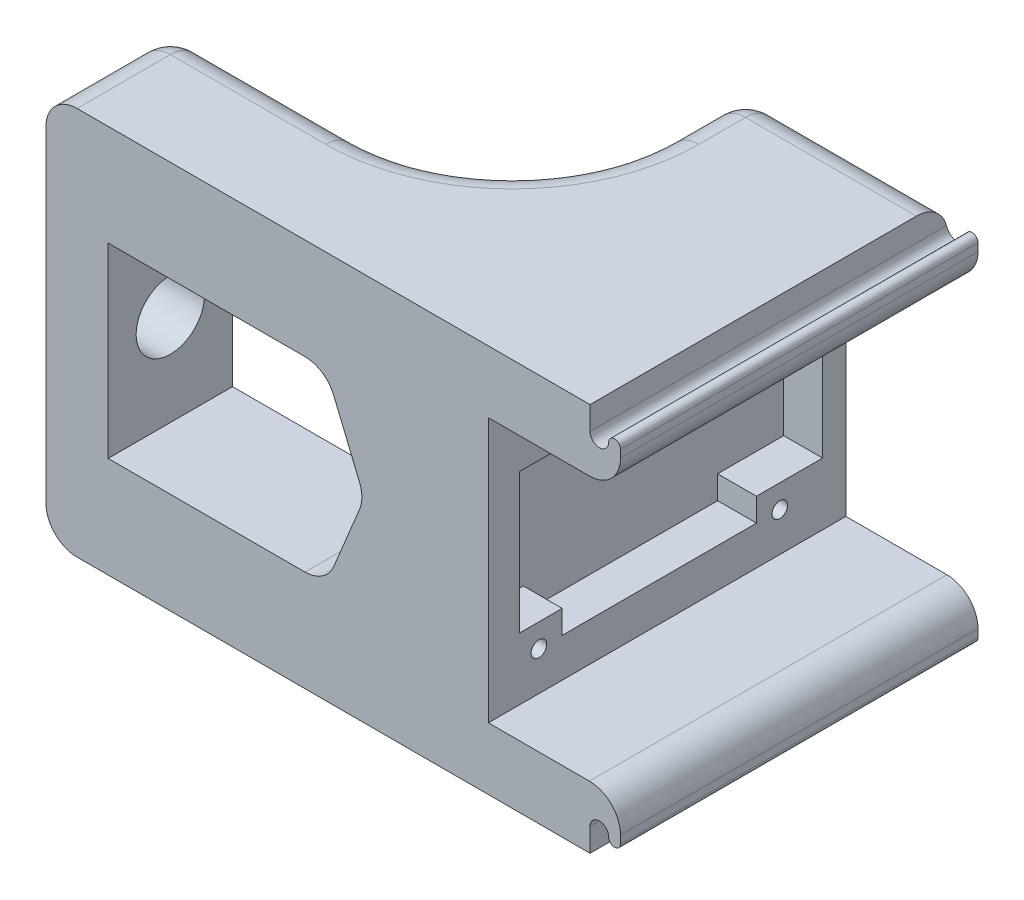
from build123d import *

# Parameters (mm, degrees)
P_IDAT_VYSUNUT_M1_DEPTH  = 8
SKICA2_R                 = 2.2
ODEBRAT_VYSUNUT_M1_DEPTH = 8
P_IDAT_VYSUNUT_M3_DEPTH  = 15
ZAOBLIT3_R               = 10
ZAOBLIT5_R               = 2
ZAOBLIT6_R               = 2
ZAOBLIT7_R               = 2
P_IDAT_VYSUNUT_M6_DEPTH  = 23
ZAOBLIT12_R              = 2
ZAOBLIT13_R              = 2
ZAOBLIT14_R              = 2
ZAOBLIT15_R              = 2
ODEBRAT_VYSUNUT_M4_DEPTH = 8.5
ZAOBLIT18_R              = 2
ZAOBLIT19_R              = 2
SKICA8_R                 = 0.5000000000000009
SKICA8_W                 = 12.000000000000004
SKICA8_H                 = 9
ODEBRAT_VYSUNUT_M5_DEPTH = 2
SKICA9_W                 = 12.000000000000004
SKICA9_H                 = 9
ODEBRAT_VYSUNUT_M6_DEPTH = 2.5


with BuildPart() as part:
    # Skica1 → Přidat vysunutím1 (new body)
    with BuildSketch(Plane.XY):
        Polygon((0, 0), (0, 25), (35, 25.000000000000004), (35, -3.47e-15), align=None)
        Polygon((3.999999999999999, 18.500000000000004), (4, 6.500000000000001), (18, 6.500000000000001), (20.485281374238575, 12.499999999999996), (18, 18.499999999999996), align=None, mode=Mode.SUBTRACT)
    extrude(amount=P_IDAT_VYSUNUT_M1_DEPTH)

    # Skica2 → Odebrat vysunutím1 (cut)
    with BuildSketch(Plane.ZY):
        with Locations((4, 12.5)):
            Circle(SKICA2_R)
    extrude(amount=-ODEBRAT_VYSUNUT_M1_DEPTH, mode=Mode.SUBTRACT)

    # Skica3 → Přidat vysunutím3 (add)
    with BuildSketch(Plane(origin=(0, 0, 0), x_dir=(-1, 0, 0), z_dir=(0, 0, -1))):
        Polygon((-35, 25.000000000000004), (-22, 25.000000000000004), (-21.999999999999996, 0), (-35, 0), align=None)
    extrude(amount=P_IDAT_VYSUNUT_M3_DEPTH)

    # Zaoblit3
    # the kernel refuses this fillet: 10 mm, written as the material it adds along each edge
    with BuildSketch(Plane(origin=(22, 25.000000000000004, 0), x_dir=(0, 0, -1), z_dir=(-1.4e-16, -1, 0))) as zaoblit3_piece_1_section:
        with BuildLine():
            CenterArc((ZAOBLIT3_R, -ZAOBLIT3_R), ZAOBLIT3_R, 90, 90)
            Line((-1.78e-15, -ZAOBLIT3_R), (0, 0))
            Line((0, 0), (ZAOBLIT3_R, 0))
        make_face()
    zaoblit3_piece_1 = extrude(amount=49.99999999999999, mode=Mode.PRIVATE)
    zaoblit3_piece_1 = split(zaoblit3_piece_1, bisect_by=Plane(origin=(17.13517134220591, 20.587881074775396, -2.4104777479798574), z_dir=(0.9238795325112865, 0.3826834323650904, 0)), keep=Keep.TOP, mode=Mode.PRIVATE)
    add(zaoblit3_piece_1)
    with BuildSketch(Plane(origin=(22, 25.000000000000004, 0), x_dir=(0, 0, -1), z_dir=(-1.4e-16, -1, 0))) as zaoblit3_piece_2_section:
        with BuildLine():
            CenterArc((ZAOBLIT3_R, -ZAOBLIT3_R), ZAOBLIT3_R, 90, 90)
            Line((-1.78e-15, -ZAOBLIT3_R), (0, 0))
            Line((0, 0), (ZAOBLIT3_R, 0))
        make_face()
    zaoblit3_piece_2 = extrude(amount=49.99999999999999, mode=Mode.PRIVATE)
    zaoblit3_piece_2 = split(zaoblit3_piece_2, bisect_by=Plane(origin=(15.789776111016284, 18.499999999999996, -0.41218867261979963), z_dir=(5.1e-16, 1, 0)), keep=Keep.TOP, mode=Mode.PRIVATE)
    add(zaoblit3_piece_2)
    with BuildSketch(Plane(origin=(22.000000000000004, 50, 0), x_dir=(0, 0, -1), z_dir=(-1.4e-16, -1, 0))) as zaoblit3_piece_3_section:
        with BuildLine():
            CenterArc((ZAOBLIT3_R, -ZAOBLIT3_R), ZAOBLIT3_R, 90, 90)
            Line((-1.78e-15, -ZAOBLIT3_R), (0, 0))
            Line((0, 0), (ZAOBLIT3_R, 0))
        make_face()
    zaoblit3_piece_3 = extrude(amount=50, mode=Mode.PRIVATE)
    zaoblit3_piece_3 = split(zaoblit3_piece_3, bisect_by=Plane(origin=(15.78977611101612, 6.500000000000001, -0.41218867261958336), z_dir=(0, -1, 0)), keep=Keep.TOP, mode=Mode.PRIVATE)
    add(zaoblit3_piece_3)
    with BuildSketch(Plane(origin=(22.000000000000004, 50, 0), x_dir=(0, 0, -1), z_dir=(-1.4e-16, -1, 0))) as zaoblit3_piece_4_section:
        with BuildLine():
            CenterArc((ZAOBLIT3_R, -ZAOBLIT3_R), ZAOBLIT3_R, 90, 90)
            Line((-1.78e-15, -ZAOBLIT3_R), (0, 0))
            Line((0, 0), (ZAOBLIT3_R, 0))
        make_face()
    zaoblit3_piece_4 = extrude(amount=50, mode=Mode.PRIVATE)
    zaoblit3_piece_4 = split(zaoblit3_piece_4, bisect_by=Plane(origin=(19.135383660262896, 9.241058631103481, -2.632109872171155), z_dir=(0.9238795325112864, -0.38268343236509067, 0)), keep=Keep.TOP, mode=Mode.PRIVATE)
    add(zaoblit3_piece_4)

    # Zaoblit5
    # the kernel refuses this fillet: 2 mm, written as the material it takes off along each edge
    with BuildSketch(Plane(origin=(0, -5, 0), x_dir=(0, 0, 1), z_dir=(0, 1, 0))) as zaoblit5_piece_1:
        with BuildLine():
            CenterArc((ZAOBLIT5_R, ZAOBLIT5_R), ZAOBLIT5_R, 180, 90)
            Line((-2.2e-16, ZAOBLIT5_R), (0, 0))
            Line((0, 0), (ZAOBLIT5_R, 0))
        make_face()
    extrude(amount=35, mode=Mode.SUBTRACT)

    # Zaoblit6
    zaoblit6_edges = [part.edges().sort_by_distance(p)[0] for p in [
        (21.999999999999996, 0, -12.5),
        (19.071067811865476, 0, -2.9289321881345254),
        (7, -6.9e-16, 0),
        (0.5857864376269049, 0, 0.5857864376269051),
        (0, 0, 5),
    ]]
    fillet(zaoblit6_edges, radius=ZAOBLIT6_R)

    # Zaoblit7
    zaoblit7_edges = [part.edges().sort_by_distance(p)[0] for p in [
        (22, 25.000000000000004, -12.5),
        (7, 25, 0),
        (19.071067811865476, 25, -2.9289321881345245),
        (0.5857864376269049, 25, 0.5857864376269051),
        (0, 25, 5),
    ]]
    fillet(zaoblit7_edges, radius=ZAOBLIT7_R)

    # Skica6 → Přidat vysunutím6 (add)
    with BuildSketch(Plane(origin=(0, 0, -15), x_dir=(-1, 0, 0), z_dir=(0, 0, -1))):
        with BuildLine():
            Line((-35, 23.500000000000004), (-35, 1.5))
            ThreePointArc((-35, 1.5), (-35.60000000229765, 2.1000000000000085), (-36.2, 1.4999999954047263))
            ThreePointArc((-36.2, 1.4999999954047263), (-36.58, 1.1199999924943909), (-36.96, 1.4999999954047263))
            Line((-36.96, 1.4999999954047263), (-36.959999999999994, 23.500000000000096))
            ThreePointArc((-36.959999999999994, 23.500000000000096), (-36.58, 23.88000000000009), (-36.2, 23.500000000000096))
            ThreePointArc((-36.2, 23.500000000000096), (-35.60000000000006, 22.9), (-35, 23.500000000000004))
        make_face()
    extrude(amount=-P_IDAT_VYSUNUT_M6_DEPTH)

    # Zaoblit12
    zaoblit12_edges = [part.edges().sort_by_distance(p)[0] for p in [
        (29.5, 0, -15),
        (22.5857864376269, 0.5857864376269046, -15),
        (29.5, 25.000000000000004, -15),
        (22.585786437626904, 24.414213562373096, -15),
        (21.999999999999996, 12.5, -15),
    ]]
    fillet(zaoblit12_edges, radius=ZAOBLIT12_R)

    # Zaoblit13
    zaoblit13_edges = [part.edges().sort_by_distance(p)[0] for p in [
        (20.485281374238724, 12.499999999999886, 1.6457513110643447),
    ]]
    fillet(zaoblit13_edges, radius=ZAOBLIT13_R)

    # Zaoblit14
    zaoblit14_edges = [part.edges().sort_by_distance(p)[0] for p in [
        (17.99999999999998, 18.500000000000004, 3.000000000000016),
    ]]
    fillet(zaoblit14_edges, radius=ZAOBLIT14_R)

    # Zaoblit15
    zaoblit15_edges = [part.edges().sort_by_distance(p)[0] for p in [
        (18.0000000000001, 6.499999999999996, 2.9999999999999263),
    ]]
    fillet(zaoblit15_edges, radius=ZAOBLIT15_R)

    # Skica7 → Odebrat vysunutím4 (cut)
    with BuildSketch(Plane(origin=(36.96, 1.166e-14, 0), x_dir=(0, 0, -1), z_dir=(1, 0, 0))):
        Polygon((-8, 21.00000000000012), (15, 21.00000000000012), (15.000000000000005, 4.000000000000118), (-7.999999999999998, 4.000000000000118), align=None)
    extrude(amount=-ODEBRAT_VYSUNUT_M4_DEPTH, mode=Mode.SUBTRACT)

    # Zaoblit18
    zaoblit18_edges = [part.edges().sort_by_distance(p)[0] for p in [
        (36.96, 21.00000000000013, -3.5),
    ]]
    fillet(zaoblit18_edges, radius=ZAOBLIT18_R)

    # Zaoblit19
    zaoblit19_edges = [part.edges().sort_by_distance(p)[0] for p in [
        (36.96, 4.00000000000013, -3.5000000000000036),
    ]]
    fillet(zaoblit19_edges, radius=ZAOBLIT19_R)

    # Skica8 → Odebrat vysunutím5 (cut)
    with BuildSketch(Plane(origin=(28.46, 0, 0), x_dir=(0, 0, -1), z_dir=(1, 0, 0))):
        with Locations((-4.750000000000001, 18.50000000000013)):
            Circle(SKICA8_R)
        with Locations((-4.750000000000001, 6.500000000000129)):
            Circle(SKICA8_R)
        with Locations((10.750000000000002, 18.50000000000013)):
            Circle(SKICA8_R)
        with Locations((10.750000000000002, 6.500000000000129)):
            Circle(SKICA8_R)
        with Locations((3.000000000000002, 12.500000000000128)):
            Rectangle(SKICA8_W, SKICA8_H)
    extrude(amount=-ODEBRAT_VYSUNUT_M5_DEPTH, mode=Mode.SUBTRACT)

    # Skica9 → Odebrat vysunutím6 (cut)
    with BuildSketch(Plane(origin=(28.46, 0, 0), x_dir=(0, 0, -1), z_dir=(1, 0, 0))):
        Polygon((-3.250000000000001, 17.000000000000128), (-5.999999999999998, 17.000000000000128), (-5.999999999999997, 8.000000000000128), (-3.2500000000000004, 8.000000000000128), (-2.9999999999999987, 8.000000000000128), (-2.9999999999999987, 17.000000000000128), align=None)
        Polygon((-3.250000000000001, 18.50000000000013), (-3.250000000000001, 17.000000000000128), (-2.9999999999999987, 17.000000000000128), (9.000000000000004, 17.000000000000128), (9.250000000000002, 17.000000000000128), (9.250000000000002, 18.50000000000013), align=None)
        Polygon((9.250000000000002, 17.000000000000128), (9.000000000000004, 17.000000000000128), (9.000000000000004, 8.000000000000128), (9.250000000000004, 8.000000000000128), (13.500000000000004, 8.000000000000128), (13.500000000000002, 17.000000000000128), align=None)
        with Locations((3.000000000000002, 12.500000000000128)):
            Rectangle(SKICA9_W, SKICA9_H)
        Polygon((-2.9999999999999987, 8.000000000000128), (-3.2500000000000004, 8.000000000000128), (-3.2500000000000004, 6.500000000000129), (9.250000000000002, 6.500000000000129), (9.250000000000002, 8.000000000000128), (9.000000000000004, 8.000000000000128), align=None)
    extrude(amount=-ODEBRAT_VYSUNUT_M6_DEPTH, mode=Mode.SUBTRACT)


solid = part.part
